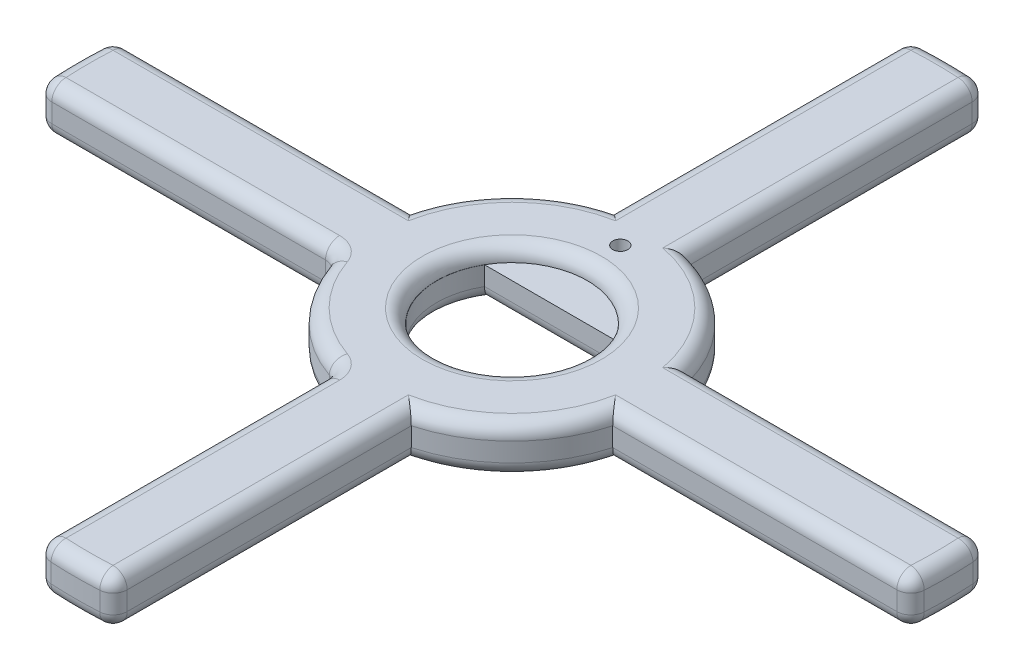
from build123d import *

# Parameters (mm, degrees)
BOSS_EXTRUDE2_DEPTH = 10
SKETCH2_R           = 16
CUT_EXTRUDE1_DEPTH  = 3
FILLET4_R           = 3
SKETCH3_R           = 1.6
CUT_EXTRUDE2_DEPTH  = 132.67455319


with BuildPart() as part:
    # Sketch1 → Boss-Extrude2 (new body)
    with BuildSketch(Plane(origin=(0, 0, 0), x_dir=(1, 0, 0), z_dir=(0, 1, 0))):
        with BuildLine():
            Line((29.390888283, 8), (92.493750971, 8))
            ThreePointArc((92.493750971, 8), (92.839075656, 0), (92.493750971, -8))
            Line((92.493750971, -8), (29.390888283, -8))
            ThreePointArc((29.390888283, -8), (21.538620128, -21.538620128), (8, -29.390888283))
            Line((8, -29.390888283), (8, -92.493750971))
            ThreePointArc((8, -92.493750971), (0, -92.839075656), (-8, -92.493750971))
            Line((-8, -92.493750971), (-8, -29.390888283))
            ThreePointArc((-8, -29.390888283), (-21.538620128, -21.538620128), (-29.390888283, -8))
            Line((-29.390888283, -8), (-92.493750971, -8))
            ThreePointArc((-92.493750971, -8), (-92.839075656, 0), (-92.493750971, 8))
            Line((-92.493750971, 8), (-29.390888283, 8))
            ThreePointArc((-29.390888283, 8), (-21.538620128, 21.538620128), (-8, 29.390888283))
            Line((-8, 29.390888283), (-8, 92.493750971))
            ThreePointArc((-8, 92.493750971), (0, 92.839075656), (8, 92.493750971))
            Line((8, 92.493750971), (8, 29.390888283))
            ThreePointArc((8, 29.390888283), (21.538620128, 21.538620128), (29.390888283, 8))
        make_face()
        with BuildLine():
            Line((-13.819052056, 8), (13.819052056, 8))
            ThreePointArc((13.819052056, 8), (0, -15.96766106), (-13.819052056, 8))
        make_face(mode=Mode.SUBTRACT)
    extrude(amount=BOSS_EXTRUDE2_DEPTH)

    # Sketch2 → Cut-Extrude1 (cut)
    with BuildSketch(Plane(origin=(0, 10, 0), x_dir=(1, 0, 0), z_dir=(0, 1, 0))):
        with Locations(Location((0, 0, 0), (0, 0, 270))):
            Circle(SKETCH2_R)
    extrude(amount=-CUT_EXTRUDE1_DEPTH, mode=Mode.SUBTRACT)

    # Fillet4
    fillet4_edges = [part.edges().sort_by_distance(p)[0] for p in [
        (0, 10, -92.839075656),
        (-8, 10, -60.942319627),
        (60.942319627, 0, -8),
        (92.839075656, 0, 0),
        (60.942319627, 0, 8),
        (21.538620128, 0, 21.538620128),
        (8, 0, 60.942319627),
        (-21.538620128, 10, -21.538620128),
        (0, 0, 92.839075656),
        (-8, 0, 60.942319627),
        (-21.538620128, 0, 21.538620128),
        (-60.942319627, 0, 8),
        (-92.839075656, 0, 0),
        (-60.942319627, 0, -8),
        (-21.538620128, 0, -21.538620128),
        (-8, 0, -60.942319627),
        (-60.942319627, 10, -8),
        (0, 0, -92.839075656),
        (8, 0, -60.942319627),
        (21.538620128, 0, -21.538620128),
        (-92.839075656, 10, 0),
        (-60.942319627, 10, 8),
        (92.493750971, 5, -8),
        (92.493750971, 5, 8),
        (8, 5, 92.493750971),
        (-8, 5, 92.493750971),
        (-8, 5, 29.390888283),
        (-29.390888283, 5, 8),
        (-92.493750971, 5, 8),
        (-92.493750971, 5, -8),
        (-8, 5, -92.493750971),
        (8, 5, -92.493750971),
        (-21.538620128, 10, 21.538620128),
        (-8, 10, 60.942319627),
        (0, 10, 92.839075656),
        (8, 10, 60.942319627),
        (0, 0, 15.96766106),
        (21.538620128, 10, -21.538620128),
        (21.538620128, 10, 21.538620128),
        (0, 0, -8),
        (60.942319627, 10, 8),
        (92.839075656, 10, 0),
        (60.942319627, 10, -8),
        (0, 10, -16),
        (8, 10, -60.942319627),
    ]]
    fillet(fillet4_edges, radius=FILLET4_R - 0.0001)  # a hair under: the kernel refuses the full size

    # Sketch3 → Cut-Extrude2 (cut, through all)
    with BuildSketch(Plane(origin=(0, 0, 0), x_dir=(-1, 0, 0), z_dir=(0, -1, 0))):
        with Locations(Location((0, 23, 0), (0, 0, 90))):
            Circle(SKETCH3_R)
    extrude(amount=-CUT_EXTRUDE2_DEPTH, mode=Mode.SUBTRACT)


solid = part.part
